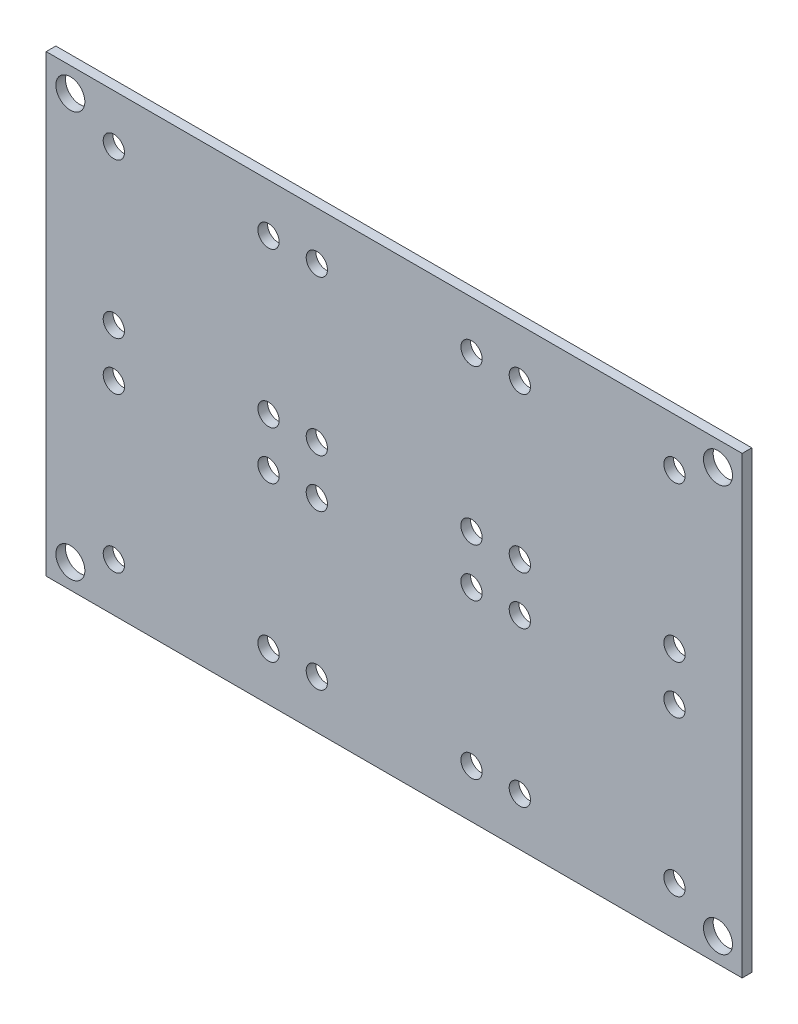
from build123d import *

# Parameters (mm, degrees)
UNIVERSAL_PLATE_OUTLINE_W = 72
UNIVERSAL_PLATE_OUTLINE_H = 47
UNIVERSAL_PLATE_OUTLINE_R = 1.5
UNIVERSAL_PLATE_DEPTH     = 1
SKETCH_2_R                = 1.1
CUT_EXTRUDE_1_DEPTH       = 89.743111904


# Read off the part's stored shape, not the designer's step: universal_plate
with BuildPart() as part:
    # universal_plate outline → universal_plate (new body)
    with BuildSketch(Plane.XY):
        with Locations((-42.465454545, 17.942880613)):
            Rectangle(UNIVERSAL_PLATE_OUTLINE_W, UNIVERSAL_PLATE_OUTLINE_H)
        with Locations((-75.965454545, -3.057119387)):
            Circle(UNIVERSAL_PLATE_OUTLINE_R, mode=Mode.SUBTRACT)
        with Locations((-8.965454545, -3.057119387)):
            Circle(UNIVERSAL_PLATE_OUTLINE_R, mode=Mode.SUBTRACT)
        with Locations((-75.965454545, 38.942880613)):
            Circle(UNIVERSAL_PLATE_OUTLINE_R, mode=Mode.SUBTRACT)
        with Locations((-8.965454545, 38.942880613)):
            Circle(UNIVERSAL_PLATE_OUTLINE_R, mode=Mode.SUBTRACT)
    extrude(amount=UNIVERSAL_PLATE_DEPTH)

    # ｽｹｯﾁ2 → ｶｯﾄ - 押し出し1 (cut, through all)
    with BuildSketch(Plane.XY.offset(1)):
        with Locations((-71.465454545, 36.442880613)):
            Circle(SKETCH_2_R)
        with Locations((-55.465454545, 36.442880613)):
            Circle(SKETCH_2_R)
        with Locations((-71.465454545, 20.442880613)):
            Circle(SKETCH_2_R)
        with Locations((-55.465454545, 20.442880613)):
            Circle(SKETCH_2_R)
        with Locations((-50.465454545, 36.442880613)):
            Circle(SKETCH_2_R)
        with Locations((-34.465454545, 36.442880613)):
            Circle(SKETCH_2_R)
        with Locations((-29.465454545, 36.442880613)):
            Circle(SKETCH_2_R)
        with Locations((-13.465454545, 36.442880613)):
            Circle(SKETCH_2_R)
        with Locations((-34.465454545, 20.442880613)):
            Circle(SKETCH_2_R)
        with Locations((-50.465454545, 20.442880613)):
            Circle(SKETCH_2_R)
        with Locations((-13.465454545, 20.442880613)):
            Circle(SKETCH_2_R)
        with Locations((-29.465454545, 20.442880613)):
            Circle(SKETCH_2_R)
        with Locations((-71.465454545, 15.442880613)):
            Circle(SKETCH_2_R)
        with Locations((-55.465454545, 15.442880613)):
            Circle(SKETCH_2_R)
        with Locations((-50.465454545, 15.442880613)):
            Circle(SKETCH_2_R)
        with Locations((-34.465454545, 15.442880613)):
            Circle(SKETCH_2_R)
        with Locations((-29.465454545, 15.442880613)):
            Circle(SKETCH_2_R)
        with Locations((-13.465454545, 15.442880613)):
            Circle(SKETCH_2_R)
        with Locations((-13.465454545, -0.557119387)):
            Circle(SKETCH_2_R)
        with Locations((-29.465454545, -0.557119387)):
            Circle(SKETCH_2_R)
        with Locations((-34.465454545, -0.557119387)):
            Circle(SKETCH_2_R)
        with Locations((-50.465454545, -0.557119387)):
            Circle(SKETCH_2_R)
        with Locations((-55.465454545, -0.557119387)):
            Circle(SKETCH_2_R)
        with Locations((-71.465454545, -0.557119387)):
            Circle(SKETCH_2_R)
    extrude(amount=-CUT_EXTRUDE_1_DEPTH, mode=Mode.SUBTRACT)


solid = part.part
